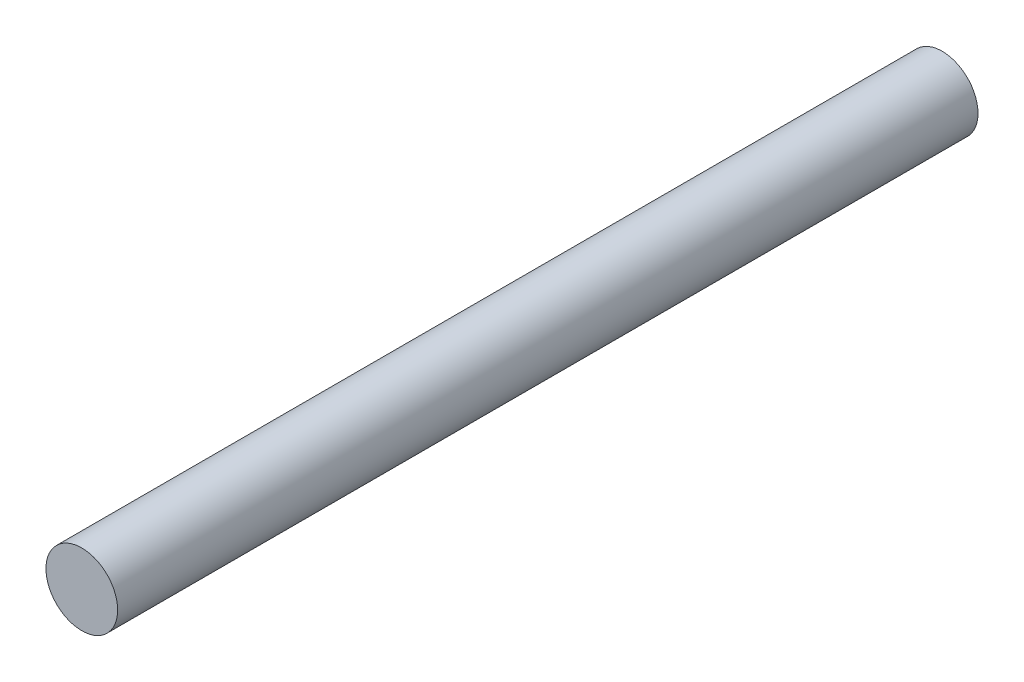
from build123d import *

# Parameters (mm, degrees)
SKETCH_3_R      = 5
EXTRUDE_1_DEPTH = 60


with BuildPart() as part:
    # 草图3 → 凸台-拉伸1 (new, symmetric)
    with BuildSketch(Plane.XY):
        Circle(SKETCH_3_R)
    extrude(amount=EXTRUDE_1_DEPTH, both=True)


solid = part.part
